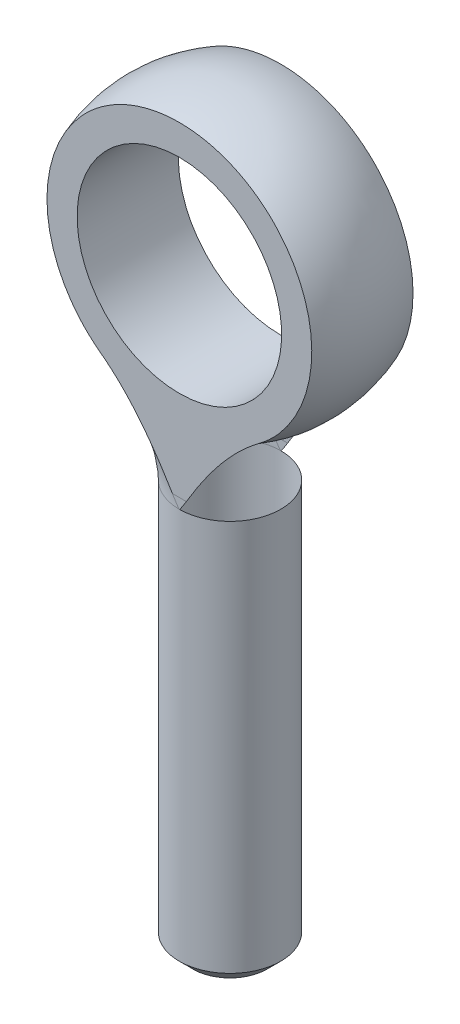
from build123d import *

# Parameters (mm, degrees)
SKETCH14_W              = 3.9751
SKETCH14_H              = 31.75
CUT_EXTRUDE10_START     = -10.379628209
CUT_EXTRUDE10_DEPTH     = 20.759256418
CUT_EXTRUDE9_DEPTH      = 34.872578542
CUT_EXTRUDE9_DEPTH_BACK = 34.872578542
SKETCH17_R              = 8.016875
CUT_EXTRUDE4_DEPTH      = 35.562321428
CUT_EXTRUDE4_DEPTH_BACK = 35.562321428
SKETCH10_R              = 3.96875
CUT_EXTRUDE7_START      = -5.55625
SKETCH22_W              = 22.225
SKETCH22_H              = 26.9875
CUT_EXTRUDE7_DEPTH      = 30.006071428
CUT_EXTRUDE8_START      = 5.55625
SKETCH23_W              = 22.225
SKETCH23_H              = 26.9875
CUT_EXTRUDE8_DEPTH      = 30.006071428
CHAMFER1_SIZE           = 1.05918
CHAMFER2_SIZE           = 0.396875


# Read off the part's stored shape, not the designer's step: Cut-Extrude10
with BuildPart() as part:
    # Sketch14 → Revolve4 (revolve)
    with BuildSketch(Plane.XY, mode=Mode.PRIVATE) as revolve4_sk:
        with Locations((1.98755, -15.875)):
            Rectangle(SKETCH14_W, SKETCH14_H)
    revolve(revolve4_sk.sketch.rotate(Axis((0, 0, 0), (0, -1, 0)), 180), axis=Axis((0, 0, 0), (0, -1, 0)))

    # Chamfer1
    chamfer1_edges = [part.edges().sort_by_distance(p)[0] for p in [
        (3.9751, -31.75, 0),
    ]]
    chamfer(chamfer1_edges, length=CHAMFER1_SIZE)


with BuildPart() as body_2:
    # Sketch21 → Revolve5 (revolve)
    with BuildSketch(Plane.XY):
        with BuildLine():
            Line((0, 26.9875), (0, 0))
            Line((0, 0), (3.9751, 0))
            ThreePointArc((3.9751, 0), (4.86426259, 4.14604002), (7.37536085, 7.562857762))
            ThreePointArc((7.37536085, 7.562857762), (10.388848273, 19.819551662), (0, 26.9875))
        make_face()
    revolve(axis=Axis((0, 0, 0), (0, -1, 0)))

    # Cut-Extrude10 outline → Cut-Extrude10 (cut)
    with BuildSketch(Plane(origin=(0, 0, 0), x_dir=(0, 0, -1), z_dir=(1, 0, 0)).offset(CUT_EXTRUDE10_START)):
        Polygon((-3.9911, -2), (-3.96875, 0.79375), (-3.96875, 28), (-12, 28), (-12, -2), align=None)
        Polygon((3.96875, 0.79375), (3.9911, -2), (12, -2), (12, 28), (3.96875, 28), align=None)
    extrude(amount=CUT_EXTRUDE10_DEPTH, mode=Mode.SUBTRACT)

    # Sketch17 → Cut-Extrude9 (cut, two sides: drawn at the far end of the back side and taken through both)
    with BuildSketch(Plane.XY.offset(-CUT_EXTRUDE9_DEPTH_BACK)):
        with Locations(Location((0, 15.875, 0), (0, 0, 270))):
            Circle(SKETCH17_R)
    extrude(amount=CUT_EXTRUDE9_DEPTH + CUT_EXTRUDE9_DEPTH_BACK, mode=Mode.SUBTRACT)

    # Combine2: union part
    add(part.part)


with BuildPart() as body_3:
    # Sketch7 → Revolve3 (revolve)
    with BuildSketch(Plane.XY):
        with BuildLine():
            Line((0, 23.8125), (0, 7.9375))
            ThreePointArc((0, 7.9375), (7.9375, 15.875), (0, 23.8125))
        make_face()
    revolve(axis=Axis((0, 0, 0), (0, 1, 0)))

    # Sketch10 → Cut-Extrude4 (cut, two sides: drawn at the far end of the back side and taken through both)
    with BuildSketch(Plane.XY.offset(-CUT_EXTRUDE4_DEPTH_BACK)):
        with Locations(Location((0, 15.875, 0), (0, 0, 180))):
            Circle(SKETCH10_R)
    extrude(amount=CUT_EXTRUDE4_DEPTH + CUT_EXTRUDE4_DEPTH_BACK, mode=Mode.SUBTRACT)

    # Sketch22 → Cut-Extrude7 (cut, through all)
    with BuildSketch(Plane.XY.offset(CUT_EXTRUDE7_START)):
        with Locations((0, 13.49375)):
            Rectangle(SKETCH22_W, SKETCH22_H)
    extrude(amount=-CUT_EXTRUDE7_DEPTH, mode=Mode.SUBTRACT)

    # Sketch23 → Cut-Extrude8 (cut, through all)
    with BuildSketch(Plane.XY.offset(CUT_EXTRUDE8_START)):
        with Locations((0, 13.49375)):
            Rectangle(SKETCH23_W, SKETCH23_H)
    extrude(amount=CUT_EXTRUDE8_DEPTH, mode=Mode.SUBTRACT)

    # Chamfer2
    chamfer2_edges = [body_3.edges().sort_by_distance(p)[0] for p in [
        (3.96875, 15.875, -5.55625),
        (3.96875, 15.875, 5.55625),
    ]]
    chamfer(chamfer2_edges, length=CHAMFER2_SIZE)


solid = body_2.part
